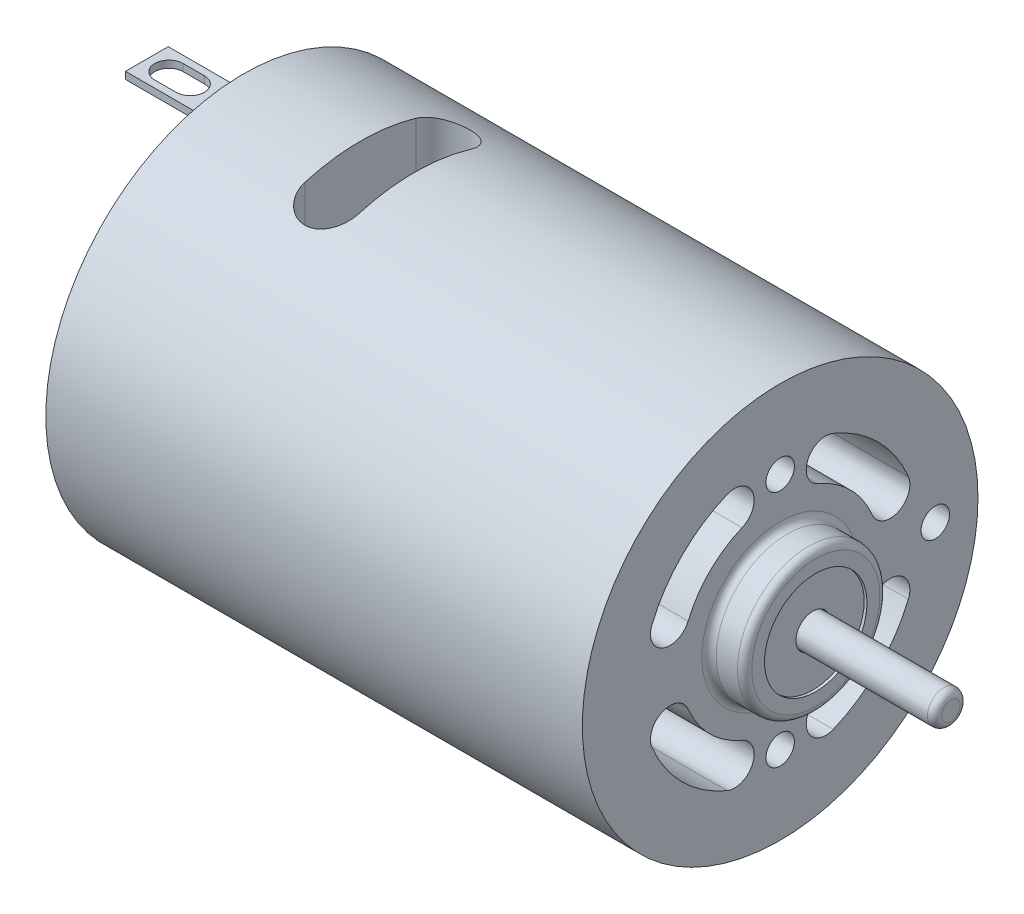
from build123d import *

# Parameters (mm, degrees)
SKETCH_1_R               = 13.9
EXTRUDE_1_DEPTH          = 37.7
CUT_EXTRUDE_1_DEPTH      = 43.517173001
CUT_EXTRUDE_1_DEPTH_BACK = 43.517173001
SKETCH_3_R               = 13.7
CUT_EXTRUDE_2_DEPTH      = 1
EXTRUDE_START            = 1
EXTRUDE_7_DEPTH          = 1
SKETCH_6_4_W             = 3
SKETCH_6_4_H             = 0.5
EXTRUDE_8_DEPTH          = 6.8
CUT_EXTRUDE_4_DEPTH      = 48.482523263
SKETCH_4_W               = 17.082447132
SKETCH_4_H               = 17
EXTRUDE_2_DEPTH          = 1
SKETCH_5_R               = 1.15
EXTRUDE_3_DEPTH          = 4
SKETCH_5_3_R             = 5
EXTRUDE_4_DEPTH          = 2
SKETCH_5_4_R             = 3
EXTRUDE_5_DEPTH          = 3
CUT_EXTRUDE_START        = 1
SKETCH_5_5_R             = 2.25
SKETCH_5_5_R_2           = 1.15
CUT_EXTRUDE_3_DEPTH      = 2
FILLET_1_R               = 1
FILLET_2_R               = 1
FILLET_3_R               = 0.5
EXTRUDE_START_2          = 2.5
SKETCH_8_R               = 5
SKETCH_8_R_2             = 3.6
EXTRUDE_9_DEPTH          = 2.5
EXTRUDE_START_3          = 2.3
SKETCH_8_3_R             = 3.6
SKETCH_8_3_R_2           = 1.2
EXTRUDE_10_DEPTH         = 2.3
EXTRUDE_START_4          = 12
SKETCH_8_4_R             = 1.15
EXTRUDE_11_DEPTH         = 12
FILLET_4_R               = 0.5
FILLET_5_R               = 0.5
FILLET_6_R               = 0.5
SKETCH_9_R               = 1
CUT_EXTRUDE_5_DEPTH      = 10
CUT_EXTRUDE_6_DEPTH      = 10
CHAMFER_1_SIZE           = 1


with BuildPart() as part:
    # 草图1 → 凸台-拉伸1 (new body)
    with BuildSketch(Plane(origin=(0, 0, 0), x_dir=(0, 0, -1), z_dir=(1, 0, 0))):
        Circle(SKETCH_1_R)
    extrude(amount=EXTRUDE_1_DEPTH)

    # 草图2 → 切除-拉伸1 (cut, two sides: drawn at the far end of the back side and taken through both)
    with BuildSketch(Plane(origin=(0, 0, 0), x_dir=(1, 0, 0), z_dir=(0, 1, 0)).offset(-CUT_EXTRUDE_1_DEPTH_BACK)):
        with BuildLine():
            Line((12, 3.9), (12, -3.9))
            ThreePointArc((12, -3.9), (10.1, -5.8), (8.2, -3.9))
            Line((8.2, -3.9), (8.2, 3.9))
            ThreePointArc((8.2, 3.9), (10.1, 5.8), (12, 3.9))
        make_face()
    extrude(amount=CUT_EXTRUDE_1_DEPTH + CUT_EXTRUDE_1_DEPTH_BACK, mode=Mode.SUBTRACT)

    # 草图3 → 切除-拉伸2 (cut)
    with BuildSketch(Plane.ZY):
        Circle(SKETCH_3_R)
    extrude(amount=-CUT_EXTRUDE_2_DEPTH, mode=Mode.SUBTRACT)

    # 草图6 → 凸台-拉伸7 (add)
    with BuildSketch(Plane.ZY.offset(-1).offset(EXTRUDE_START)):
        with BuildLine():
            Line((-3.85, -9.1), (-3.85, -13.147908579))
            ThreePointArc((-3.85, -13.147908579), (0, -13.7), (3.85, -13.147908579))
            Line((3.85, -13.147908579), (3.85, -9.1))
            Line((3.85, -9.1), (-3.85, -9.1))
        make_face()
        with BuildLine():
            Line((3.85, 9.1), (3.85, 13.147908579))
            ThreePointArc((3.85, 13.147908579), (0, 13.7), (-3.85, 13.147908579))
            Line((-3.85, 13.147908579), (-3.85, 9.1))
            Line((-3.85, 9.1), (3.85, 9.1))
        make_face()
    extrude(amount=-EXTRUDE_7_DEPTH)

    # 草图6<4> → 凸台-拉伸8 (add)
    with BuildSketch(Plane.ZY.offset(-1).offset(EXTRUDE_START)):
        with Locations((0, -11.15)):
            Rectangle(SKETCH_6_4_W, SKETCH_6_4_H)
        with Locations((0, 11.15)):
            Rectangle(SKETCH_6_4_W, SKETCH_6_4_H)
    extrude(amount=EXTRUDE_8_DEPTH)

    # 草图7 → 切除-拉伸4 (cut, through all)
    with BuildSketch(Plane.XZ.offset(11.4)):
        with BuildLine():
            Line((-5.25, 1), (-3.75, 1))
            ThreePointArc((-3.75, 1), (-2.75, 0), (-3.75, -1))
            Line((-3.75, -1), (-5.25, -1))
            ThreePointArc((-5.25, -1), (-6.25, 0), (-5.25, 1))
        make_face()
    extrude(amount=-CUT_EXTRUDE_4_DEPTH, mode=Mode.SUBTRACT)

    # 草图4 → 凸台-拉伸2 (add)
    with BuildSketch(Plane.ZY.offset(-1)):
        Rectangle(SKETCH_4_W, SKETCH_4_H)
        with BuildLine():
            ThreePointArc((-8.541223566, 8.5), (-12.05, 0), (-8.541223566, -8.5))
            Line((-8.541223566, -8.5), (-8.541223566, 8.5))
        make_face()
        with BuildLine():
            Line((8.541223566, 8.5), (8.541223566, -8.5))
            ThreePointArc((8.541223566, -8.5), (11.138317736, -4.597866681), (12.05, 0))
            ThreePointArc((12.05, 0), (11.138317736, 4.597866681), (8.541223566, 8.5))
        make_face()
    extrude(amount=EXTRUDE_2_DEPTH)

    # 草图5 → 凸台-拉伸3 (add)
    with BuildSketch(Plane.ZY):
        Circle(SKETCH_5_R)
    extrude(amount=EXTRUDE_3_DEPTH)

    # 草图5<3> → 凸台-拉伸4 (add)
    with BuildSketch(Plane.ZY):
        Circle(SKETCH_5_3_R)
    extrude(amount=EXTRUDE_4_DEPTH)

    # 草图5<4> → 凸台-拉伸5 (add)
    with BuildSketch(Plane.ZY):
        Circle(SKETCH_5_4_R)
    extrude(amount=EXTRUDE_5_DEPTH)

    # 草图5<5> → 切除-拉伸3 (cut)
    with BuildSketch(Plane.ZY.offset(CUT_EXTRUDE_START)):
        Circle(SKETCH_5_5_R)
        Circle(SKETCH_5_5_R_2, mode=Mode.SUBTRACT)
    extrude(amount=CUT_EXTRUDE_3_DEPTH, mode=Mode.SUBTRACT)

    # 圆角1
    fillet_1_edges = [part.edges().sort_by_distance(p)[0] for p in [
        (-2, 0, -5),
    ]]
    fillet(fillet_1_edges, radius=FILLET_1_R)

    # 圆角2
    # the kernel refuses this fillet: 1 mm, written as the material it takes off along each edge
    with BuildSketch(Plane(origin=(-3, 0, 0), x_dir=(0, 0, 1), z_dir=(0, -1, 0))) as fillet_2_piece_1:
        with BuildLine():
            CenterArc((2, -0.968245837), FILLET_2_R, 0, 75.522487814)
            Line((2.25, 0), (2.255, 0.019364917))
            ThreePointArc((2.255, 0.019364917), (2.625, 0.02), (3, 0.02))
            Line((3, 0.02), (3.02, 0))
            Line((3.02, 0), (3.02, -0.968245837))
            Line((3.02, -0.968245837), (3, -0.968245837))
        make_face()
    revolve(axis=Axis((-3, 0, 0), (-1, 0, 0)), mode=Mode.SUBTRACT)

    # 圆角3
    fillet_3_edges = [part.edges().sort_by_distance(p)[0] for p in [
        (-4, 0, -1.15),
    ]]
    fillet(fillet_3_edges, radius=FILLET_3_R)

    # 草图8 → 凸台-拉伸9 (add)
    with BuildSketch(Plane(origin=(37.7, 0, 0), x_dir=(0, 0, -1), z_dir=(1, 0, 0)).offset(EXTRUDE_START_2)):
        with Locations(Location((0, 0, 0), (0, 0, 180))):
            Circle(SKETCH_8_R)
        Circle(SKETCH_8_R_2, mode=Mode.SUBTRACT)
    extrude(amount=-EXTRUDE_9_DEPTH)

    # 草图8<3> → 凸台-拉伸10 (add)
    with BuildSketch(Plane(origin=(37.7, 0, 0), x_dir=(0, 0, -1), z_dir=(1, 0, 0)).offset(EXTRUDE_START_3)):
        Circle(SKETCH_8_3_R)
        Circle(SKETCH_8_3_R_2, mode=Mode.SUBTRACT)
    extrude(amount=-EXTRUDE_10_DEPTH)

    # 草图8<4> → 凸台-拉伸11 (add)
    with BuildSketch(Plane(origin=(37.7, 0, 0), x_dir=(0, 0, -1), z_dir=(1, 0, 0)).offset(EXTRUDE_START_4)):
        with Locations(Location((0, 0, 0), (0, 0, 180))):
            Circle(SKETCH_8_4_R)
    extrude(amount=-EXTRUDE_11_DEPTH)

    # 圆角4
    fillet_4_edges = [part.edges().sort_by_distance(p)[0] for p in [
        (49.7, 0, -1.15),
    ]]
    fillet(fillet_4_edges, radius=FILLET_4_R)

    # 圆角5
    fillet_5_edges = [part.edges().sort_by_distance(p)[0] for p in [
        (40.2, 0, -5),
    ]]
    fillet(fillet_5_edges, radius=FILLET_5_R)

    # 圆角6
    fillet_6_edges = [part.edges().sort_by_distance(p)[0] for p in [
        (37.7, 0, -5),
    ]]
    fillet(fillet_6_edges, radius=FILLET_6_R)

    # 草图9 → 切除-拉伸5 (cut)
    with BuildSketch(Plane(origin=(37.7, 0, 0), x_dir=(0, 0, -1), z_dir=(1, 0, 0))):
        with BuildLine():
            ThreePointArc((2.678784005, 6.467156736), (4.949747468, 4.949747469), (6.467156736, 2.678784007))
            ThreePointArc((6.467156736, 2.678784007), (8.263680795, 1.934639385), (9.007825457, 3.731163428))
            ThreePointArc((9.007825457, 3.731163428), (6.894291133, 6.894291101), (3.73116347, 9.00782544))
            ThreePointArc((3.73116347, 9.00782544), (1.934639394, 8.263680817), (2.678784005, 6.467156736))
        make_face()
        with BuildLine():
            ThreePointArc((6.467156717, -2.678784053), (4.949747444, -4.949747493), (2.678783989, -6.467156743))
            ThreePointArc((2.678783989, -6.467156743), (1.934639389, -8.263680806), (3.731163431, -9.007825456))
            ThreePointArc((3.731163431, -9.007825456), (6.894291089, -6.894291144), (9.007825426, -3.731163503))
            ThreePointArc((9.007825426, -3.731163503), (8.26368081, -1.934639391), (6.467156717, -2.678784053))
        make_face()
        with BuildLine():
            ThreePointArc((-6.467156725, 2.678784033), (-4.949747462, 4.949747474), (-2.678784018, 6.467156731))
            ThreePointArc((-2.678784018, 6.467156731), (-1.934639392, 8.263680811), (-3.73116347, 9.00782544))
            ThreePointArc((-3.73116347, 9.00782544), (-6.894291136, 6.894291097), (-9.007825462, 3.731163418))
            ThreePointArc((-9.007825462, 3.731163418), (-8.263680777, 1.934639378), (-6.467156725, 2.678784033))
        make_face()
        with BuildLine():
            ThreePointArc((-2.678783959, -6.467156756), (-4.949747445, -4.949747491), (-6.46715673, -2.67878402))
            ThreePointArc((-6.46715673, -2.67878402), (-8.26368081, -1.934639391), (-9.00782544, -3.73116347))
            ThreePointArc((-9.00782544, -3.73116347), (-6.894291156, -6.894291077), (-3.731163573, -9.007825397))
            ThreePointArc((-3.731163573, -9.007825397), (-1.934639425, -8.263680892), (-2.678783959, -6.467156756))
        make_face()
        with Locations((0, 8.375)):
            Circle(SKETCH_9_R)
        with Locations((0, -8.375)):
            Circle(SKETCH_9_R)
        with Locations((10.9, 0)):
            Circle(SKETCH_9_R)
    extrude(amount=-CUT_EXTRUDE_5_DEPTH, mode=Mode.SUBTRACT)

    # 草图11 → 切除-拉伸6 (cut)
    with BuildSketch(Plane.ZY):
        with BuildLine():
            Line((-7.25, 7.25), (-7.25, 2.8))
            Line((-7.25, 2.8), (-5.86600375, 2.8))
            ThreePointArc((-5.86600375, 2.8), (-4.596194078, 4.596194078), (-2.8, 5.86600375))
            Line((-2.8, 5.86600375), (-2.8, 7.25))
            Line((-2.8, 7.25), (-7.25, 7.25))
        make_face()
        with BuildLine():
            Line((2.8, 7.25), (2.8, 5.86600375))
            ThreePointArc((2.8, 5.86600375), (4.596194078, 4.596194078), (5.86600375, 2.8))
            Line((5.86600375, 2.8), (7.25, 2.8))
            Line((7.25, 2.8), (7.25, 7.25))
            Line((7.25, 7.25), (2.8, 7.25))
        make_face()
        with BuildLine():
            ThreePointArc((5.86600375, -2.8), (4.596194078, -4.596194078), (2.8, -5.86600375))
            Line((2.8, -5.86600375), (2.8, -7.25))
            Line((2.8, -7.25), (7.25, -7.25))
            Line((7.25, -7.25), (7.25, -2.8))
            Line((7.25, -2.8), (5.86600375, -2.8))
        make_face()
        with BuildLine():
            Line((-5.86600375, -2.8), (-7.25, -2.8))
            Line((-7.25, -2.8), (-7.25, -7.25))
            Line((-7.25, -7.25), (-2.8, -7.25))
            Line((-2.8, -7.25), (-2.8, -5.86600375))
            ThreePointArc((-2.8, -5.86600375), (-4.596194078, -4.596194078), (-5.86600375, -2.8))
        make_face()
    extrude(amount=-CUT_EXTRUDE_6_DEPTH, mode=Mode.SUBTRACT)

    # 倒角1
    chamfer_1_edges = [part.edges().sort_by_distance(p)[0] for p in [
        (5, -7.25, -7.25),
        (5, -7.25, 7.25),
        (5, 7.25, 7.25),
        (5, 7.25, -7.25),
    ]]
    chamfer(chamfer_1_edges, length=CHAMFER_1_SIZE)


solid = part.part
